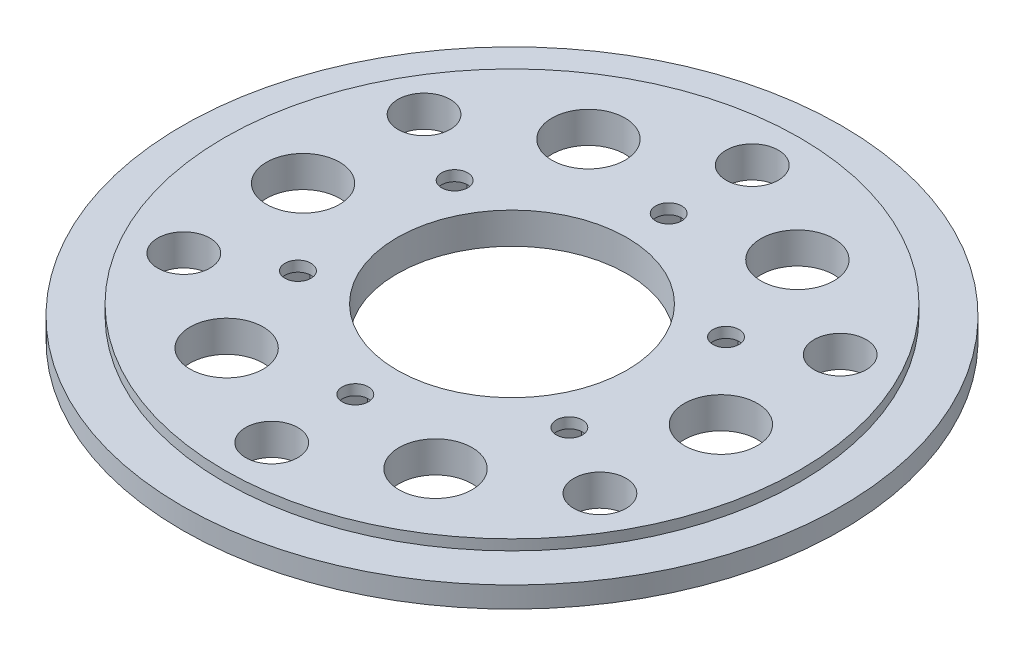
from build123d import *

# Parameters (mm, degrees)
SKETCH1_R             = 27.55
SKETCH1_R_2           = 11
BOSS_EXTRUDE1_DEPTH   = 3
SKETCH1_3_R           = 31.55
SKETCH1_3_R_2         = 27.55
BOSS_EXTRUDE2_DEPTH   = 2
M3X0_5_TAPPED_HOLE1_D = 2.5
SKETCH6_R             = 3.5
SKETCH6_R_2           = 2.5
CUT_EXTRUDE1_DEPTH    = 45.719179331
CIRPATTERN1_COUNT     = 6
CUT_EXTRUDE2_DEPTH    = 2
CIRPATTERN2_COUNT     = 6


with BuildPart() as part:
    # Sketch1 → Boss-Extrude1 (new body)
    with BuildSketch(Plane(origin=(0, 0, 0), x_dir=(1, 0, 0), z_dir=(0, 1, 0))):
        Circle(SKETCH1_R)
        Circle(SKETCH1_R_2, mode=Mode.SUBTRACT)
    extrude(amount=BOSS_EXTRUDE1_DEPTH)

    # Sketch1<3> → Boss-Extrude2 (add)
    with BuildSketch(Plane(origin=(0, 0, 0), x_dir=(1, 0, 0), z_dir=(0, 1, 0))):
        Circle(SKETCH1_3_R)
        Circle(SKETCH1_3_R_2, mode=Mode.SUBTRACT)
    extrude(amount=BOSS_EXTRUDE2_DEPTH)

    # M3x0.5 Tapped Hole1 (through all)
    with Locations(Plane(origin=(0, 3, 0), x_dir=(1, 0, 0), z_dir=(0, 1, 0))):
        with Locations((0, 15)):
            m3x0_5_tapped_hole1 = Hole(M3X0_5_TAPPED_HOLE1_D / 2)

    # Sketch6 → Cut-Extrude1 (cut, through all)
    with BuildSketch(Plane(origin=(0, 3, 0), x_dir=(1, 0, 0), z_dir=(0, 1, 0))):
        with Locations((20, 0)):
            Circle(SKETCH6_R)
        with Locations((0, 23)):
            Circle(SKETCH6_R_2)
    cut_extrude1 = extrude(amount=-CUT_EXTRUDE1_DEPTH, mode=Mode.SUBTRACT)

    # CirPattern1: M3x0.5 Tapped Hole1, Cut-Extrude1 ×6 about axis
    cirpattern1_axis = Axis((0, 3, 0), (0, -1, 0))
    add([m3x0_5_tapped_hole1.rotate(cirpattern1_axis, i * 360 / CIRPATTERN1_COUNT) for i in range(1, CIRPATTERN1_COUNT)], mode=Mode.SUBTRACT)
    add([cut_extrude1.rotate(cirpattern1_axis, i * 360 / CIRPATTERN1_COUNT) for i in range(1, CIRPATTERN1_COUNT)], mode=Mode.SUBTRACT)

    # Sketch7 → Cut-Extrude2 (cut)
    with BuildSketch(Plane.XZ):
        Polygon((1.58771324, 12.25), (3.175426481, 15), (1.58771324, 17.75), (-1.58771324, 17.75), (-3.175426481, 15), (-1.58771324, 12.25), align=None)
    cut_extrude2 = extrude(amount=-CUT_EXTRUDE2_DEPTH, mode=Mode.SUBTRACT)

    # CirPattern2: Cut-Extrude2 ×6 about axis
    cirpattern2_axis = Axis((0, 3, 0), (0, -1, 0))
    for i in range(1, CIRPATTERN2_COUNT):
        add(cut_extrude2.rotate(cirpattern2_axis, i * 360 / CIRPATTERN2_COUNT), mode=Mode.SUBTRACT)


solid = part.part
